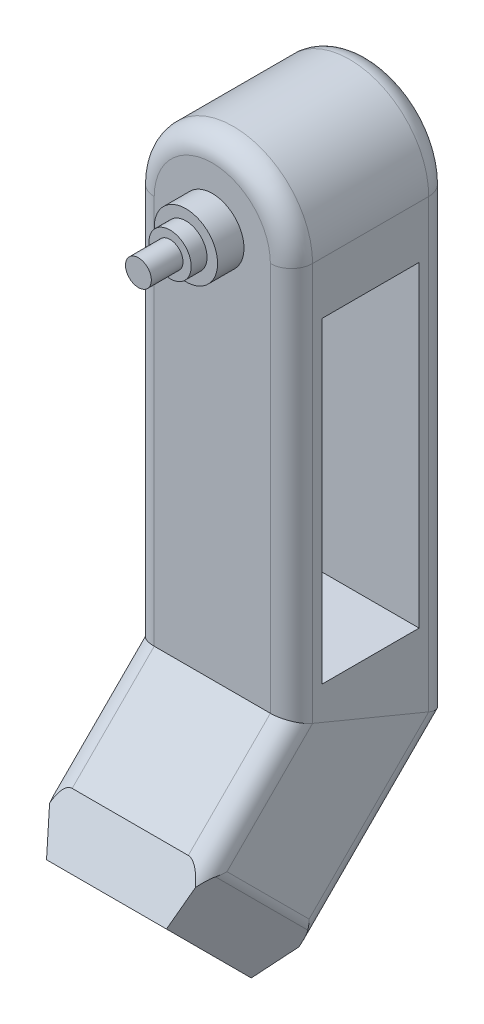
from build123d import *

# Parameters (mm, degrees)
SKETCH11_W          = 38.1
SKETCH11_H          = 38.1
SKETCH12_W          = 38.1
SKETCH12_H          = 38.1
BOSS_EXTRUDE5_DEPTH = 12.7
BOSS_EXTRUDE5_TAPER = 20
BOSS_EXTRUDE6_DEPTH = 38.1
SKETCH15_R          = 12.065
CUT_EXTRUDE3_DEPTH  = 25.4
SKETCH16_W          = 23.310601064
SKETCH16_H          = 76.2
CUT_EXTRUDE4_DEPTH  = 59.830675793
SKETCH17_R          = 7.62
BOSS_EXTRUDE7_DEPTH = 6.35
SKETCH18_R          = 5.08
BOSS_EXTRUDE8_DEPTH = 3.81
SKETCH19_R          = 3.1115
BOSS_EXTRUDE9_DEPTH = 7.62
FILLET2_R           = 5.08


with BuildPart() as part:
    # Sweep1: sweep along a path in Sketch10
    with BuildLine(Plane(origin=(0, 0, 0), x_dir=(0, 0, -1), z_dir=(1, 0, 0))) as sweep1_path:
        Line((0, 96.393), (0, -5.207))
        Line((0, -5.207), (-25.324322261, -30.531322261))
    # Sketch11 → Sweep1 (sweep)
    with BuildSketch(Plane(origin=(0, 96.393, 0), x_dir=(1, 0, 0), z_dir=(0, 1, 0))):
        Rectangle(SKETCH11_W, SKETCH11_H)
    sweep(path=sweep1_path.line, transition=Transition.RIGHT)

    # Sketch12 → Boss-Extrude5 (add)
    with BuildSketch(Plane(origin=(0, -27.927822261, 27.927822261), x_dir=(1, 0, 0), z_dir=(0, -0.7071067811865461, 0.7071067811865489))):
        with Locations((0, -3.68190501)):
            Rectangle(SKETCH12_W, SKETCH12_H)
    extrude(amount=BOSS_EXTRUDE5_DEPTH, taper=BOSS_EXTRUDE5_TAPER)

    # Sketch13 → Boss-Extrude6 (add)
    with BuildSketch(Plane(origin=(0, 0, -19.05), x_dir=(-1, 0, 0), z_dir=(0, 0, -1))):
        with BuildLine():
            Line((-19.05, 96.393), (19.05, 96.393))
            ThreePointArc((19.05, 96.393), (0, 115.443), (-19.05, 96.393))
        make_face()
    extrude(amount=-BOSS_EXTRUDE6_DEPTH)

    # Sketch15 → Cut-Extrude3 (cut)
    with BuildSketch(Plane(origin=(0, -36.908078382, 36.908078382), x_dir=(1, 0, 0), z_dir=(0, -0.7071067811865461, 0.7071067811865489))):
        with Locations(Location((0, -3.68190501, 0), (0, 0, 270))):
            Circle(SKETCH15_R)
    extrude(amount=-CUT_EXTRUDE3_DEPTH, mode=Mode.SUBTRACT)

    # Sketch16 → Cut-Extrude4 (cut)
    with BuildSketch(Plane(origin=(19.05, 0, 0), x_dir=(0, 0, -1), z_dir=(1, 0, 0))):
        with Locations((0, 45.72)):
            Rectangle(SKETCH16_W, SKETCH16_H)
    extrude(amount=-CUT_EXTRUDE4_DEPTH, mode=Mode.SUBTRACT)

    # Sketch17 → Boss-Extrude7 (add)
    with BuildSketch(Plane.XY.offset(19.05)):
        with Locations(Location((0, 96.393, 0), (0, 0, 90))):
            Circle(SKETCH17_R)
    extrude(amount=BOSS_EXTRUDE7_DEPTH)

    # Sketch18 → Boss-Extrude8 (add)
    with BuildSketch(Plane.XY.offset(25.4)):
        with Locations(Location((0, 96.393, 0), (0, 0, 180))):
            Circle(SKETCH18_R)
    extrude(amount=BOSS_EXTRUDE8_DEPTH)

    # Sketch19 → Boss-Extrude9 (add)
    with BuildSketch(Plane.XY.offset(29.21)):
        with Locations(Location((0, 96.393, 0), (0, 0, 180))):
            Circle(SKETCH19_R)
    extrude(amount=BOSS_EXTRUDE9_DEPTH)

    # Fillet2
    # the kernel refuses this fillet: 5.08 mm, written as the material it takes off along each edge
    with BuildSketch(Plane(origin=(19.05, 96.393, 19.05), x_dir=(-1, 0, 0), z_dir=(0, -1, 0))) as fillet2_piece_1_section:
        with BuildLine():
            CenterArc((FILLET2_R, FILLET2_R), FILLET2_R, 180, 90)
            Line((0, FILLET2_R), (0, 0))
            Line((0, 0), (FILLET2_R, 0))
        make_face()
    fillet2_piece_1 = extrude(amount=106.409231637, mode=Mode.PRIVATE)
    fillet2_piece_1 = split(fillet2_piece_1, bisect_by=Plane(origin=(17.892257619, 26.96392305, -5.230154687), z_dir=(0, 0.7071067811865489, 0.7071067811865462)), keep=Keep.TOP, mode=Mode.PRIVATE)
    add(fillet2_piece_1, mode=Mode.SUBTRACT)
    with BuildSketch(Plane(origin=(19.05, 96.393, -19.05), x_dir=(0, 0, 1), z_dir=(0, -1, 0))) as fillet2_piece_2:
        with BuildLine():
            CenterArc((FILLET2_R, FILLET2_R), FILLET2_R, 180, 90)
            Line((0, FILLET2_R), (0, 0))
            Line((0, 0), (FILLET2_R, 0))
        make_face()
    extrude(amount=122.190768363, mode=Mode.SUBTRACT)
    with BuildSketch(Plane(origin=(19.05, 11.664024484, 10.069743879), x_dir=(-1, 0, 0), z_dir=(0, -0.7071067811865462, 0.7071067811865489))) as fillet2_piece_3_section:
        with BuildLine():
            CenterArc((FILLET2_R, FILLET2_R), FILLET2_R, 180, 90)
            Line((0, FILLET2_R), (0, 0))
            Line((0, 0), (FILLET2_R, 0))
        make_face()
    fillet2_piece_3 = extrude(amount=53.323231637, mode=Mode.PRIVATE)
    fillet2_piece_3 = split(fillet2_piece_3, bisect_by=Plane(origin=(17.881962417, -12.866336341, 19.05), z_dir=(0, 0, 1)), keep=Keep.TOP, mode=Mode.PRIVATE)
    add(fillet2_piece_3, mode=Mode.SUBTRACT)
    with BuildSketch(Plane(origin=(19.05, -4.117512242, -28.030256121), x_dir=(0, 0.7071067811865489, 0.7071067811865462), z_dir=(0, -0.7071067811865462, 0.7071067811865489))) as fillet2_piece_4:
        with BuildLine():
            CenterArc((FILLET2_R, FILLET2_R), FILLET2_R, 180, 90)
            Line((0, FILLET2_R), (0, 0))
            Line((0, 0), (FILLET2_R, 0))
        make_face()
    extrude(amount=69.104768363, mode=Mode.SUBTRACT)
    with BuildSketch(Plane(origin=(-19.05, -4.117512242, -28.030256121), x_dir=(0, 0.7071067811865488, 0.7071067811865461), z_dir=(0, -0.7071067811865462, 0.7071067811865489))) as fillet2_piece_5:
        with BuildLine():
            CenterArc((FILLET2_R, -FILLET2_R), FILLET2_R, 90, 90)
            Line((0, -FILLET2_R), (0, 0))
            Line((0, 0), (FILLET2_R, 0))
        make_face()
    extrude(amount=69.104768363, mode=Mode.SUBTRACT)
    with BuildSketch(Plane(origin=(-19.05, 11.664024484, 10.069743879), x_dir=(0, -0.7071067811865489, -0.7071067811865462), z_dir=(0, -0.7071067811865462, 0.7071067811865489))) as fillet2_piece_6_section:
        with BuildLine():
            CenterArc((FILLET2_R, FILLET2_R), FILLET2_R, 180, 90)
            Line((0, FILLET2_R), (0, 0))
            Line((0, 0), (FILLET2_R, 0))
        make_face()
    fillet2_piece_6 = extrude(amount=53.323231637, mode=Mode.PRIVATE)
    fillet2_piece_6 = split(fillet2_piece_6, bisect_by=Plane(origin=(-17.881962417, -12.866336341, 19.05), z_dir=(0, 0, 1)), keep=Keep.TOP, mode=Mode.PRIVATE)
    add(fillet2_piece_6, mode=Mode.SUBTRACT)
    with BuildSketch(Plane(origin=(19.05, -15.477476632, 40.378167891), x_dir=(0, 0.7071067811865461, -0.7071067811865488), z_dir=(0, -0.7071067811865489, -0.7071067811865462)), Plane(origin=(-19.05, -45.585167891, 10.270476632), x_dir=(0, 0.7071067811865461, -0.7071067811865489), z_dir=(0, 0.7071067811865489, 0.7071067811865462))) as fillet2_piece_7:
        with BuildLine():
            CenterArc((FILLET2_R * 0.176326980708, -FILLET2_R), FILLET2_R, 90, 20)
            Line((-FILLET2_R * 0.165693162617, -FILLET2_R * 0.0603073792141), (0, 0))
            Line((0, 0), (FILLET2_R * 0.176326980708, 0))
        make_face()
    extrude(amount=42.57870531, mode=Mode.SUBTRACT)
    with BuildSketch(Plane(origin=(-19.05, 96.393, -19.05), x_dir=(0, 0, 1), z_dir=(0, -1, 0))) as fillet2_piece_8:
        with BuildLine():
            CenterArc((FILLET2_R, -FILLET2_R), FILLET2_R, 90, 90)
            Line((0, -FILLET2_R), (0, 0))
            Line((0, 0), (FILLET2_R, 0))
        make_face()
    extrude(amount=122.190768363, mode=Mode.SUBTRACT)
    with BuildSketch(Plane(origin=(-19.05, 96.393, 19.05), x_dir=(1, 0, 0), z_dir=(0, -1, 0))) as fillet2_piece_9_section:
        with BuildLine():
            CenterArc((FILLET2_R, -FILLET2_R), FILLET2_R, 90, 90)
            Line((0, -FILLET2_R), (0, 0))
            Line((0, 0), (FILLET2_R, 0))
        make_face()
    fillet2_piece_9 = extrude(amount=106.409231637, mode=Mode.PRIVATE)
    fillet2_piece_9 = split(fillet2_piece_9, bisect_by=Plane(origin=(-17.892257619, 26.96392305, -5.230154687), z_dir=(0, 0.7071067811865489, 0.7071067811865462)), keep=Keep.TOP, mode=Mode.PRIVATE)
    add(fillet2_piece_9, mode=Mode.SUBTRACT)
    with BuildSketch(Plane(origin=(0, 96.393, -19.05), x_dir=(-1, 0, 0), z_dir=(0, -1, 0))) as fillet2_piece_10:
        with BuildLine():
            CenterArc((19.05 - FILLET2_R, -FILLET2_R), FILLET2_R, 0, 90)
            Line((19.05 - FILLET2_R, 0), (19.05, 0))
            Line((19.05, 0), (19.05, -FILLET2_R))
        make_face()
    revolve(axis=Axis((0, 96.393, -19.05), (0, 0, -1)), revolution_arc=180, mode=Mode.SUBTRACT)
    with BuildSketch(Plane(origin=(0, 96.393, 19.05), x_dir=(-1, 0, 0), z_dir=(0, -1, 0))) as fillet2_piece_11:
        with BuildLine():
            CenterArc((19.05 - FILLET2_R, FILLET2_R), FILLET2_R, 270, 90)
            Line((19.05, FILLET2_R), (19.05, 0))
            Line((19.05, 0), (19.05 - FILLET2_R, 0))
        make_face()
    revolve(axis=Axis((0, 96.393, 19.05), (0, 0, -1)), revolution_arc=180, mode=Mode.SUBTRACT)
    with BuildSketch(Plane(origin=(19.05, 96.393, 19.05), x_dir=(-1, 0, 0), z_dir=(0, -1, 0))) as fillet2_piece_12a_section:
        with BuildLine():
            CenterArc((FILLET2_R, FILLET2_R), FILLET2_R, 180, 90)
            Line((0, FILLET2_R), (0, 0))
            Line((0, 0), (FILLET2_R, 0))
        make_face()
    fillet2_piece_12a = extrude(amount=106.409231637, mode=Mode.PRIVATE)
    fillet2_piece_12a = split(fillet2_piece_12a, bisect_by=Plane(origin=(17.951071981, 0.436282509, 21.297485854), z_dir=(0, -0.7071067811865489, -0.7071067811865462)), keep=Keep.TOP, mode=Mode.PRIVATE)
    with BuildSketch(Plane(origin=(19.05, 11.664024484, 10.069743879), x_dir=(-1, 0, 0), z_dir=(0, -0.7071067811865462, 0.7071067811865489))) as fillet2_piece_12b_section:
        with BuildLine():
            CenterArc((FILLET2_R, FILLET2_R), FILLET2_R, 180, 90)
            Line((0, FILLET2_R), (0, 0))
            Line((0, 0), (FILLET2_R, 0))
        make_face()
    fillet2_piece_12b = extrude(amount=53.323231637, mode=Mode.PRIVATE)
    fillet2_piece_12b = split(fillet2_piece_12b, bisect_by=Plane(origin=(17.951071981, 5.862193339, 19.05), z_dir=(0, 0, -1)), keep=Keep.TOP, mode=Mode.PRIVATE)
    fillet2_piece_12 = fillet2_piece_12a & fillet2_piece_12b
    add(fillet2_piece_12, mode=Mode.SUBTRACT)
    with BuildSketch(Plane(origin=(-19.05, 96.393, 19.05), x_dir=(1, 0, 0), z_dir=(0, -1, 0))) as fillet2_piece_13a_section:
        with BuildLine():
            CenterArc((FILLET2_R, -FILLET2_R), FILLET2_R, 90, 90)
            Line((0, -FILLET2_R), (0, 0))
            Line((0, 0), (FILLET2_R, 0))
        make_face()
    fillet2_piece_13a = extrude(amount=106.409231637, mode=Mode.PRIVATE)
    fillet2_piece_13a = split(fillet2_piece_13a, bisect_by=Plane(origin=(-17.951071981, 0.436282509, 21.297485854), z_dir=(0, -0.7071067811865489, -0.7071067811865462)), keep=Keep.TOP, mode=Mode.PRIVATE)
    with BuildSketch(Plane(origin=(-19.05, 11.664024484, 10.069743879), x_dir=(0, -0.7071067811865489, -0.7071067811865462), z_dir=(0, -0.7071067811865462, 0.7071067811865489))) as fillet2_piece_13b_section:
        with BuildLine():
            CenterArc((FILLET2_R, FILLET2_R), FILLET2_R, 180, 90)
            Line((0, FILLET2_R), (0, 0))
            Line((0, 0), (FILLET2_R, 0))
        make_face()
    fillet2_piece_13b = extrude(amount=53.323231637, mode=Mode.PRIVATE)
    fillet2_piece_13b = split(fillet2_piece_13b, bisect_by=Plane(origin=(-17.951071981, 5.862193339, 19.05), z_dir=(0, 0, -1)), keep=Keep.TOP, mode=Mode.PRIVATE)
    fillet2_piece_13 = fillet2_piece_13a & fillet2_piece_13b
    add(fillet2_piece_13, mode=Mode.SUBTRACT)


solid = part.part
